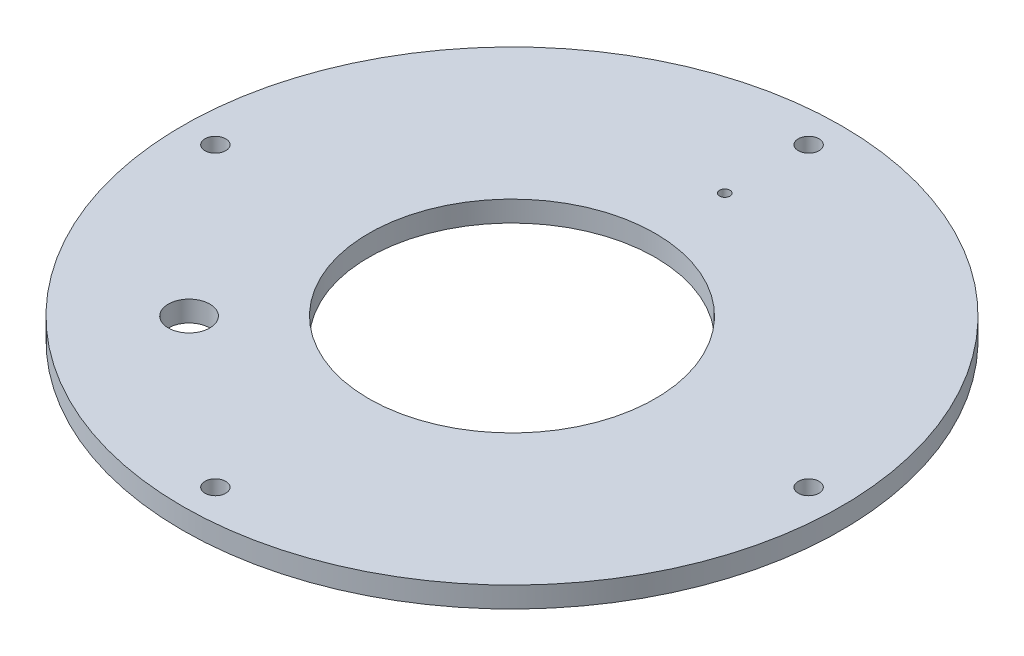
from build123d import *

# Parameters (mm, degrees)
SKETCH1_R                                       = 15.875
SKETCH1_R_2                                     = 6.9
BOSS_EXTRUDE1_DEPTH                             = 1
CSK_FOR_M2_FLAT_HEAD_MACHINE_SCREW1_D           = 1
CSK_FOR_M2_FLAT_HEAD_MACHINE_SCREW1_CSINK_D     = 1.6
CSK_FOR_M2_FLAT_HEAD_MACHINE_SCREW1_CSINK_ANGLE = 100
CUT_EXTRUDE1_DEPTH                              = 23.472900347
CUT_EXTRUDE1_DEPTH_BACK                         = 23.472900347
SKETCH4_R                                       = 0.25
SKETCH4_R_2                                     = 1


with BuildPart() as part:
    # Sketch1 → Boss-Extrude1 (new body)
    with BuildSketch(Plane(origin=(0, 0, 0), x_dir=(1, 0, 0), z_dir=(0, 1, 0))):
        Circle(SKETCH1_R)
        Circle(SKETCH1_R_2, mode=Mode.SUBTRACT)
    extrude(amount=BOSS_EXTRUDE1_DEPTH)

    # CSK for M2 Flat Head Machine Screw1 (through all)
    with Locations(Plane(origin=(0, 0, 0), x_dir=(-1, 0, 0), z_dir=(0, -1, 0))):
        with Locations((0, -14.29), (-14.29, 0), (0, 14.29), (14.29, 0)):
            CounterSinkHole(CSK_FOR_M2_FLAT_HEAD_MACHINE_SCREW1_D / 2, CSK_FOR_M2_FLAT_HEAD_MACHINE_SCREW1_CSINK_D / 2, counter_sink_angle=CSK_FOR_M2_FLAT_HEAD_MACHINE_SCREW1_CSINK_ANGLE)

    # Sketch4 → Cut-Extrude1 (cut, two sides: drawn at the far end of the back side and taken through both)
    with BuildSketch(Plane(origin=(0, 1, 0), x_dir=(1, 0, 0), z_dir=(0, 1, 0)).offset(-CUT_EXTRUDE1_DEPTH_BACK)):
        with Locations((0, 10.25)):
            Circle(SKETCH4_R)
        with Locations((-7.778174593, -7.778174593)):
            Circle(SKETCH4_R_2)
    extrude(amount=CUT_EXTRUDE1_DEPTH + CUT_EXTRUDE1_DEPTH_BACK, mode=Mode.SUBTRACT)


solid = part.part
